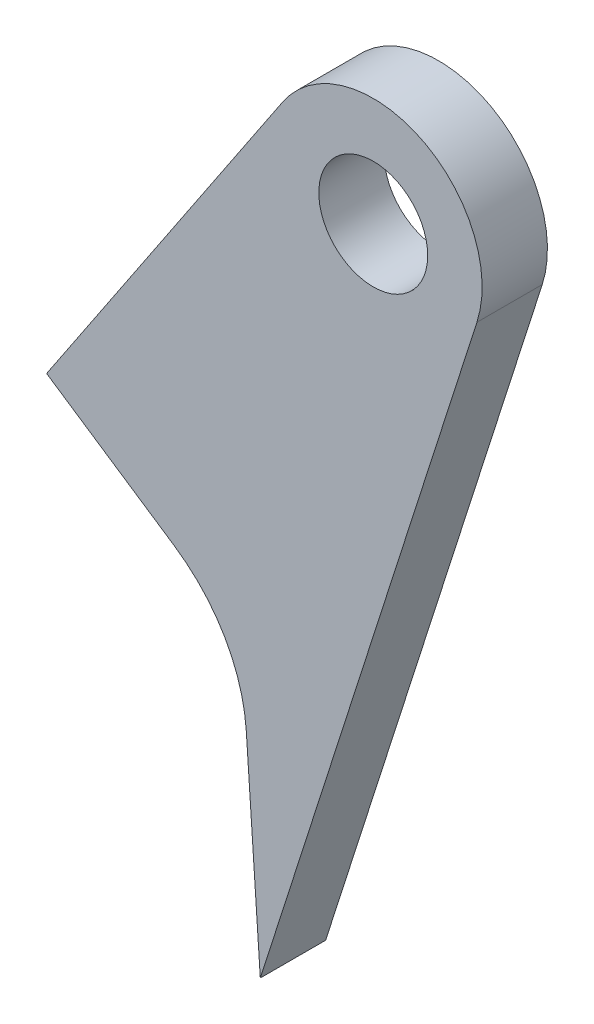
from build123d import *

# Parameters (mm, degrees)
BASE_EXTRUDE_DEPTH = 6
HOLE1_START        = 9
HOLE1_OUTLINE_R    = 5
HOLE1_DEPTH        = 6


# Read off the part's stored shape, not the designer's step: Hole1
with BuildPart() as part:
    # Sketch1 → Base-Extrude (new body)
    with BuildSketch(Plane(origin=(0, 0, 15), x_dir=(-1, 0, 0), z_dir=(0, 0, -1))):
        with BuildLine():
            Line((-35.94095366, -10), (-34.656774357, 8.985563209))
            ThreePointArc((-34.656774357, 8.985563209), (-32.674273273, 15.485526346), (-28.02703118, 20.443648194))
            Line((-28.02703118, 20.443648194), (-16.313883273, 28.273529827))
            Line((-16.313883273, 28.273529827), (-38.001708808, 60.717533475))
            ThreePointArc((-38.001708808, 60.717533475), (-50.661713644, 64.166190146), (-55.838522693, 52.109258389))
            Line((-55.838522693, 52.109258389), (-35.94095366, -10))
        make_face()
    extrude(amount=BASE_EXTRUDE_DEPTH)

    # Hole1 outline → Hole1 (cut)
    with BuildSketch(Plane.XY.offset(HOLE1_START)):
        with Locations((46.315287905, 55.160159761)):
            Circle(HOLE1_OUTLINE_R)
    extrude(amount=HOLE1_DEPTH, mode=Mode.SUBTRACT)


solid = part.part
